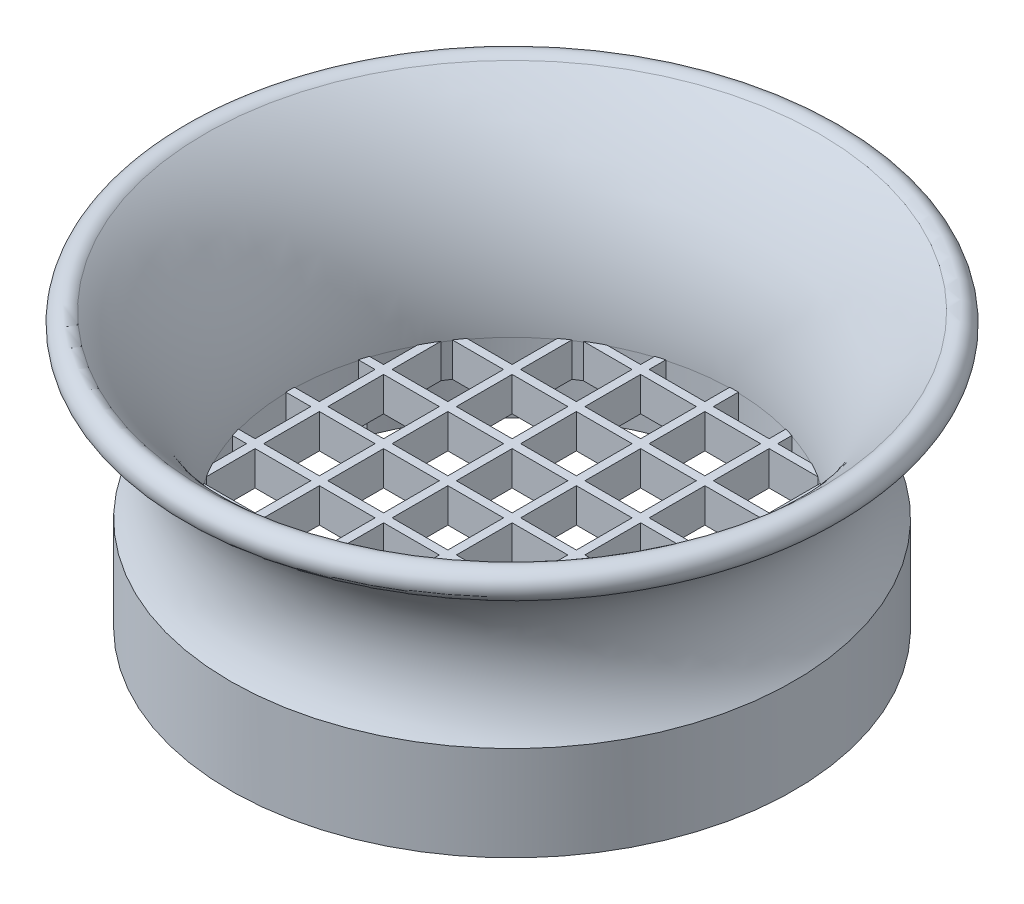
from build123d import *

# Parameters (mm, degrees)
SKETCH3_W                     = 73.117228083
SKETCH3_H                     = 27.94
CUT_EXTRUDE2_DEPTH            = 77.417046659
SKETCH4_W                     = 1.27
SKETCH4_H                     = 76.454
SKETCH4_H_2                   = 74.026267188
SKETCH4_H_3                   = 66.21110622
SKETCH4_H_4                   = 50.569567684
EXTRUDE_THIN1_DEPTH           = 5.08
CIRPATTERN1_COPY_1_SKETCH_W   = 1.27
CIRPATTERN1_COPY_1_SKETCH_H   = 76.454
CIRPATTERN1_COPY_1_SKETCH_H_2 = 74.026267188
CIRPATTERN1_COPY_1_SKETCH_H_3 = 66.21110622
CIRPATTERN1_COPY_1_SKETCH_H_4 = 50.569567684
CIRPATTERN1_COPY_1_DEPTH      = 5.08
CIRPATTERN1_COPY_2_SKETCH_W   = 1.27
CIRPATTERN1_COPY_2_SKETCH_H   = 76.454
CIRPATTERN1_COPY_2_SKETCH_H_2 = 74.026267188
CIRPATTERN1_COPY_2_SKETCH_H_3 = 66.21110622
CIRPATTERN1_COPY_2_SKETCH_H_4 = 50.569567684
CIRPATTERN1_COPY_2_DEPTH      = 5.08
CIRPATTERN1_COPY_3_SKETCH_W   = 1.27
CIRPATTERN1_COPY_3_SKETCH_H   = 76.454
CIRPATTERN1_COPY_3_SKETCH_H_2 = 74.026267188
CIRPATTERN1_COPY_3_SKETCH_H_3 = 66.21110622
CIRPATTERN1_COPY_3_SKETCH_H_4 = 50.569567684
CIRPATTERN1_COPY_3_DEPTH      = 5.08
CIRPATTERN1_COPY_4_SKETCH_W   = 1.27
CIRPATTERN1_COPY_4_SKETCH_H   = 76.454
CIRPATTERN1_COPY_4_SKETCH_H_2 = 74.026267188
CIRPATTERN1_COPY_4_SKETCH_H_3 = 66.21110622
CIRPATTERN1_COPY_4_SKETCH_H_4 = 50.569567684
CIRPATTERN1_COPY_4_DEPTH      = 5.08
CIRPATTERN1_COPY_5_SKETCH_W   = 1.27
CIRPATTERN1_COPY_5_SKETCH_H   = 76.454
CIRPATTERN1_COPY_5_SKETCH_H_2 = 74.026267188
CIRPATTERN1_COPY_5_SKETCH_H_3 = 66.21110622
CIRPATTERN1_COPY_5_SKETCH_H_4 = 50.569567684
CIRPATTERN1_COPY_5_DEPTH      = 5.08
CIRPATTERN1_COPY_6_SKETCH_W   = 1.27
CIRPATTERN1_COPY_6_SKETCH_H   = 76.454
CIRPATTERN1_COPY_6_SKETCH_H_2 = 74.026267188
CIRPATTERN1_COPY_6_SKETCH_H_3 = 66.21110622
CIRPATTERN1_COPY_6_SKETCH_H_4 = 50.569567684
CIRPATTERN1_COPY_6_DEPTH      = 5.08


with BuildPart() as part:
    # Sketch1 → Revolve1 (revolve)
    with BuildSketch(Plane.XY):
        with BuildLine():
            Line((33.02, 0), (33.02, 4.986848865))
            ThreePointArc((33.02, 4.986848865), (36.352885555, 19.767536883), (45.706492673, 31.687557784))
            ThreePointArc((45.706492673, 31.687557784), (48.725517929, 31.169120759), (47.800543634, 28.24889594))
            ThreePointArc((47.800543634, 28.24889594), (39.147072259, 18.063334122), (41.91, 4.986848865))
            Line((41.91, 4.986848865), (41.91, -9.084636901))
            Line((41.91, -9.084636901), (38.227, -9.084636901))
            Line((38.227, -9.084636901), (38.227, 0))
            Line((38.227, 0), (33.02, 0))
        make_face()
    revolve(axis=Axis((0, 0, 0), (0, 1, 0)))

    # Sketch3 → Cut-Extrude2 (cut, through all)
    with BuildSketch(Plane.XZ):
        with Locations((-36.558614042, 0)):
            Rectangle(SKETCH3_W, SKETCH3_H)
    extrude(amount=CUT_EXTRUDE2_DEPTH, mode=Mode.SUBTRACT)

    # Sketch4 → Extrude-Thin1 (add)
    with BuildSketch(Plane(origin=(0, 0, 0), x_dir=(1, 0, 0), z_dir=(0, 1, 0))):
        Rectangle(SKETCH4_W, SKETCH4_H)
        with Locations((9.55675, 0)):
            Rectangle(SKETCH4_W, SKETCH4_H_2)
        with Locations((19.1135, 0)):
            Rectangle(SKETCH4_W, SKETCH4_H_3)
        with Locations((28.67025, 0)):
            Rectangle(SKETCH4_W, SKETCH4_H_4)
    extrude_thin1 = extrude(amount=EXTRUDE_THIN1_DEPTH)

    # Mirror1: Extrude-Thin1 across plane
    add(extrude_thin1.mirror(Plane(origin=(0, 0, 0), x_dir=(0, 0, 1), z_dir=(1, 0, 0))))

    # CirPattern1 copy 1 sketch → CirPattern1 copy 1 (add)
    with BuildSketch(Plane(origin=(0, 0, 0), x_dir=(0, 0, -1), z_dir=(0, 1, 0))):
        Rectangle(CIRPATTERN1_COPY_1_SKETCH_W, CIRPATTERN1_COPY_1_SKETCH_H)
        with Locations((9.55675, 0)):
            Rectangle(CIRPATTERN1_COPY_1_SKETCH_W, CIRPATTERN1_COPY_1_SKETCH_H_2)
        with Locations((19.1135, 0)):
            Rectangle(CIRPATTERN1_COPY_1_SKETCH_W, CIRPATTERN1_COPY_1_SKETCH_H_3)
        with Locations((28.67025, 0)):
            Rectangle(CIRPATTERN1_COPY_1_SKETCH_W, CIRPATTERN1_COPY_1_SKETCH_H_4)
    extrude(amount=CIRPATTERN1_COPY_1_DEPTH)

    # CirPattern1 copy 2 sketch → CirPattern1 copy 2 (add)
    with BuildSketch(Plane(origin=(0, 0, 0), x_dir=(1, 0, 0), z_dir=(0, 1, 0))):
        Rectangle(CIRPATTERN1_COPY_2_SKETCH_W, CIRPATTERN1_COPY_2_SKETCH_H)
        with Locations((9.55675, 0)):
            Rectangle(CIRPATTERN1_COPY_2_SKETCH_W, CIRPATTERN1_COPY_2_SKETCH_H_2)
        with Locations((19.1135, 0)):
            Rectangle(CIRPATTERN1_COPY_2_SKETCH_W, CIRPATTERN1_COPY_2_SKETCH_H_3)
        with Locations((28.67025, 0)):
            Rectangle(CIRPATTERN1_COPY_2_SKETCH_W, CIRPATTERN1_COPY_2_SKETCH_H_4)
    extrude(amount=CIRPATTERN1_COPY_2_DEPTH)

    # CirPattern1 copy 3 sketch → CirPattern1 copy 3 (add)
    with BuildSketch(Plane.ZX):
        Rectangle(CIRPATTERN1_COPY_3_SKETCH_W, CIRPATTERN1_COPY_3_SKETCH_H)
        with Locations((9.55675, 0)):
            Rectangle(CIRPATTERN1_COPY_3_SKETCH_W, CIRPATTERN1_COPY_3_SKETCH_H_2)
        with Locations((19.1135, 0)):
            Rectangle(CIRPATTERN1_COPY_3_SKETCH_W, CIRPATTERN1_COPY_3_SKETCH_H_3)
        with Locations((28.67025, 0)):
            Rectangle(CIRPATTERN1_COPY_3_SKETCH_W, CIRPATTERN1_COPY_3_SKETCH_H_4)
    extrude(amount=CIRPATTERN1_COPY_3_DEPTH)

    # CirPattern1 copy 4 sketch → CirPattern1 copy 4 (add)
    with BuildSketch(Plane.ZX):
        Rectangle(CIRPATTERN1_COPY_4_SKETCH_W, CIRPATTERN1_COPY_4_SKETCH_H)
        with Locations((9.55675, 0)):
            Rectangle(CIRPATTERN1_COPY_4_SKETCH_W, CIRPATTERN1_COPY_4_SKETCH_H_2)
        with Locations((19.1135, 0)):
            Rectangle(CIRPATTERN1_COPY_4_SKETCH_W, CIRPATTERN1_COPY_4_SKETCH_H_3)
        with Locations((28.67025, 0)):
            Rectangle(CIRPATTERN1_COPY_4_SKETCH_W, CIRPATTERN1_COPY_4_SKETCH_H_4)
    extrude(amount=CIRPATTERN1_COPY_4_DEPTH)

    # CirPattern1 copy 5 sketch → CirPattern1 copy 5 (add)
    with BuildSketch(Plane(origin=(0, 0, 0), x_dir=(-1, 0, 0), z_dir=(0, 1, 0))):
        Rectangle(CIRPATTERN1_COPY_5_SKETCH_W, CIRPATTERN1_COPY_5_SKETCH_H)
        with Locations((9.55675, 0)):
            Rectangle(CIRPATTERN1_COPY_5_SKETCH_W, CIRPATTERN1_COPY_5_SKETCH_H_2)
        with Locations((19.1135, 0)):
            Rectangle(CIRPATTERN1_COPY_5_SKETCH_W, CIRPATTERN1_COPY_5_SKETCH_H_3)
        with Locations((28.67025, 0)):
            Rectangle(CIRPATTERN1_COPY_5_SKETCH_W, CIRPATTERN1_COPY_5_SKETCH_H_4)
    extrude(amount=CIRPATTERN1_COPY_5_DEPTH)

    # CirPattern1 copy 6 sketch → CirPattern1 copy 6 (add)
    with BuildSketch(Plane(origin=(0, 0, 0), x_dir=(0, 0, -1), z_dir=(0, 1, 0))):
        Rectangle(CIRPATTERN1_COPY_6_SKETCH_W, CIRPATTERN1_COPY_6_SKETCH_H)
        with Locations((9.55675, 0)):
            Rectangle(CIRPATTERN1_COPY_6_SKETCH_W, CIRPATTERN1_COPY_6_SKETCH_H_2)
        with Locations((19.1135, 0)):
            Rectangle(CIRPATTERN1_COPY_6_SKETCH_W, CIRPATTERN1_COPY_6_SKETCH_H_3)
        with Locations((28.67025, 0)):
            Rectangle(CIRPATTERN1_COPY_6_SKETCH_W, CIRPATTERN1_COPY_6_SKETCH_H_4)
    extrude(amount=CIRPATTERN1_COPY_6_DEPTH)


solid = part.part
